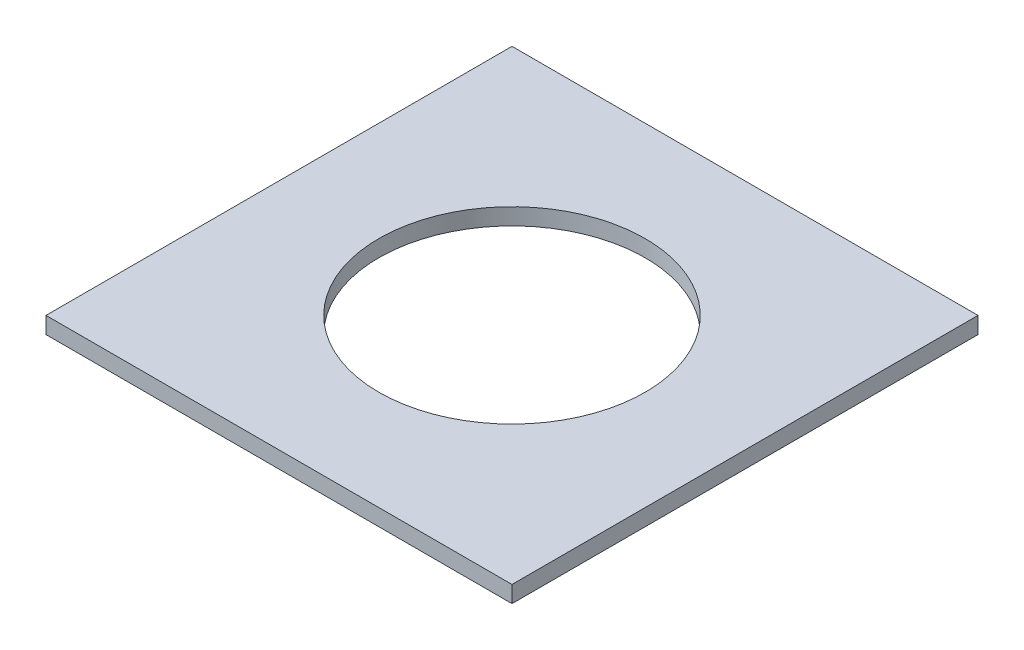
from build123d import *

# Parameters (mm, degrees)
SKETCH1_W           = 14
SKETCH1_H           = 14
SKETCH1_R           = 4
BOSS_EXTRUDE1_DEPTH = 0.5


with BuildPart() as part:
    # Sketch1 → Boss-Extrude1 (new body)
    with BuildSketch(Plane(origin=(0, 0, 0), x_dir=(1, 0, 0), z_dir=(0, 1, 0))):
        Rectangle(SKETCH1_W, SKETCH1_H)
        Circle(SKETCH1_R, mode=Mode.SUBTRACT)
    extrude(amount=BOSS_EXTRUDE1_DEPTH)


solid = part.part
